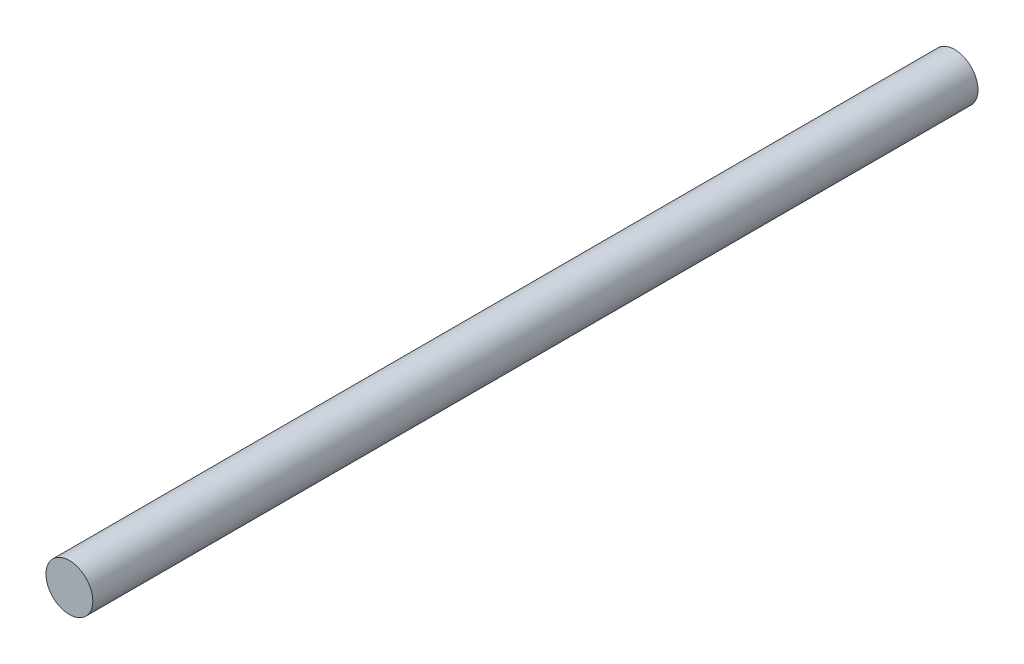
from build123d import *

# Parameters (mm, degrees)
SKETCH1_R           = 1.5875
BOSS_EXTRUDE1_DEPTH = 60


with BuildPart() as part:
    # Sketch1 → Boss-Extrude1 (new body)
    with BuildSketch(Plane.XY):
        Circle(SKETCH1_R)
    extrude(amount=BOSS_EXTRUDE1_DEPTH)


solid = part.part
